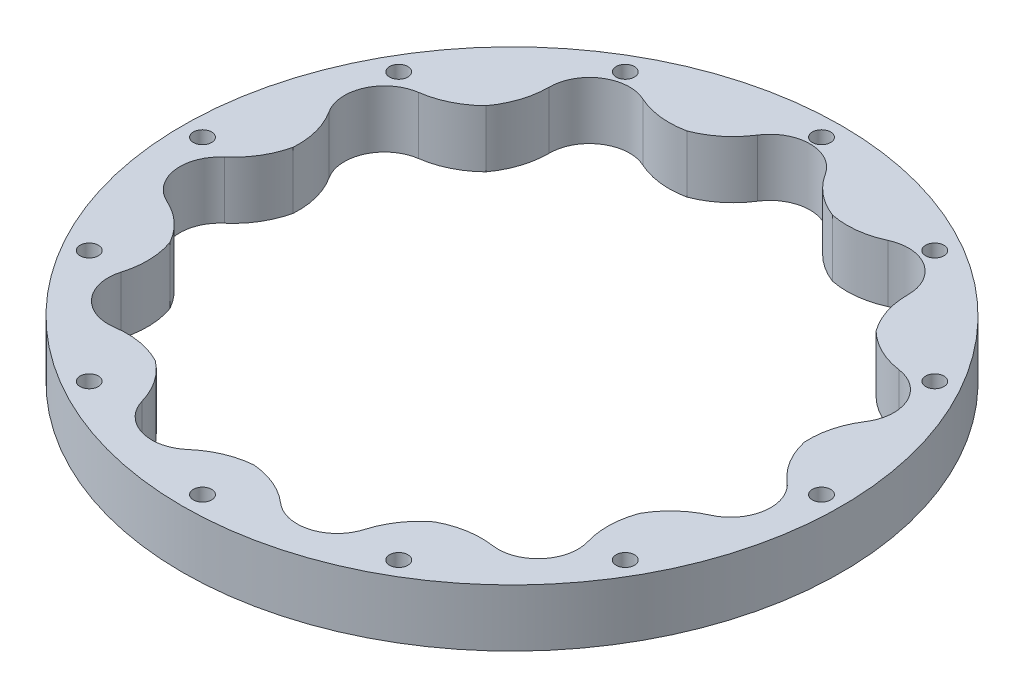
from build123d import *

# Parameters (mm, degrees)
SKETCH1_R           = 57.5
SKETCH1_R_2         = 1.6
BOSS_EXTRUDE1_DEPTH = 10
FILLET1_R           = 14


with BuildPart() as part:
    # Sketch1 → Boss-Extrude1 (new body)
    with BuildSketch(Plane(origin=(0, 0, 0), x_dir=(1, 0, 0), z_dir=(0, 1, 0))):
        with Locations(Location((0, 0, 0), (0, 0, 270))):
            Circle(SKETCH1_R)
        with Locations(Location((-27, -46.765371804, 0), (0, 0, 270))):
            Circle(SKETCH1_R_2, mode=Mode.SUBTRACT)
        with Locations(Location((-46.765371804, -27, 0), (0, 0, 270))):
            Circle(SKETCH1_R_2, mode=Mode.SUBTRACT)
        with Locations(Location((-54, 0, 0), (0, 0, 270))):
            Circle(SKETCH1_R_2, mode=Mode.SUBTRACT)
        with Locations(Location((0, -54, 0), (0, 0, 270))):
            Circle(SKETCH1_R_2, mode=Mode.SUBTRACT)
        with Locations(Location((27, -46.765371804, 0), (0, 0, 270))):
            Circle(SKETCH1_R_2, mode=Mode.SUBTRACT)
        with Locations(Location((46.765371804, -27, 0), (0, 0, 270))):
            Circle(SKETCH1_R_2, mode=Mode.SUBTRACT)
        with Locations(Location((-46.765371804, 27, 0), (0, 0, 270))):
            Circle(SKETCH1_R_2, mode=Mode.SUBTRACT)
        with Locations(Location((-27, 46.765371804, 0), (0, 0, 270))):
            Circle(SKETCH1_R_2, mode=Mode.SUBTRACT)
        with BuildLine():
            ThreePointArc((43.337291938, 12.119369929), (44.541964885, 6.404167722), (44.996248187, 0.581075772))
            ThreePointArc((44.996248187, 0.581075772), (49.649801174, -1.617727663), (51.541964885, -6.404167722))
            ThreePointArc((51.541964885, -6.404167722), (48.916629323, -11.868809619), (43.009876012, -13.234446171))
            ThreePointArc((43.009876012, -13.234446171), (40.933439791, -18.693675585), (38.167406032, -23.837976356))
            ThreePointArc((38.167406032, -23.837976356), (40.258159872, -26.3152212), (41.008730846, -29.468733028))
            ThreePointArc((41.008730846, -29.468733028), (36.666623102, -35.944503928), (29.027128345, -34.386419122))
            ThreePointArc((29.027128345, -34.386419122), (24.328836786, -37.856408977), (19.22068214, -40.688639423))
            ThreePointArc((19.22068214, -40.688639423), (19.562695248, -41.91207899), (19.677965058, -43.177183813))
            ThreePointArc((19.677965058, -43.177183813), (13.403758509, -50.139455271), (5.828472525, -44.620946965))
            ThreePointArc((5.828472525, -44.620946965), (0, -45), (-5.828472525, -44.620946965))
            ThreePointArc((-5.828472525, -44.620946965), (-14.650092956, -49.893634628), (-19.22068214, -40.688639423))
            ThreePointArc((-19.22068214, -40.688639423), (-24.328836785, -37.856408977), (-29.027128345, -34.386419122))
            ThreePointArc((-29.027128345, -34.386419122), (-39.298977866, -34.052758165), (-38.167406032, -23.837976356))
            ThreePointArc((-38.167406032, -23.837976356), (-40.933439791, -18.693675585), (-43.009876012, -13.234446171))
            ThreePointArc((-43.009876012, -13.234446171), (-51.470714978, -7.40037159), (-44.996248187, 0.581075772))
            ThreePointArc((-44.996248187, 0.581075772), (-44.541964885, 6.404167722), (-43.337291938, 12.119369929))
            ThreePointArc((-43.337291938, 12.119369929), (-47.300863758, 21.601580676), (-37.539099471, 24.815640449))
            ThreePointArc((-37.539099471, 24.815640449), (-34.008730846, 29.468733028), (-29.905423881, 33.625371708))
            ThreePointArc((-29.905423881, 33.625371708), (-28.113322508, 43.745183707), (-18.163551911, 41.171414622))
            ThreePointArc((-18.163551911, 41.171414622), (-12.677965058, 43.177183813), (-6.978795043, 44.455555556))
            ThreePointArc((-6.978795043, 44.455555556), (-0.272428616, 51.994696752), (7, 45))
            ThreePointArc((7, 45), (6.994696752, 44.727571384), (6.978795043, 44.455555556))
            ThreePointArc((6.978795043, 44.455555556), (12.677965058, 43.177183813), (18.163551911, 41.171414622))
            ThreePointArc((18.163551911, 41.171414622), (26.038077243, 44.644523374), (31.328836786, 37.856408977))
            ThreePointArc((31.328836786, 37.856408977), (30.963447161, 35.624381834), (29.905423881, 33.625371708))
            ThreePointArc((29.905423881, 33.625371708), (34.008730846, 29.468733028), (37.539099471, 24.815640449))
            ThreePointArc((37.539099471, 24.815640449), (44.485876825, 24.725274968), (47.933439791, 18.693675585))
            ThreePointArc((47.933439791, 18.693675585), (46.670467115, 14.68287548), (43.337291938, 12.119369929))
        make_face(mode=Mode.SUBTRACT)
        with Locations(Location((54, 0, 0), (0, 0, 270))):
            Circle(SKETCH1_R_2, mode=Mode.SUBTRACT)
        with Locations(Location((46.765371804, 27, 0), (0, 0, 270))):
            Circle(SKETCH1_R_2, mode=Mode.SUBTRACT)
        with Locations(Location((0, 54, 0), (0, 0, 270))):
            Circle(SKETCH1_R_2, mode=Mode.SUBTRACT)
        with Locations(Location((27, 46.765371804, 0), (0, 0, 270))):
            Circle(SKETCH1_R_2, mode=Mode.SUBTRACT)
    extrude(amount=BOSS_EXTRUDE1_DEPTH)

    # Fillet1
    # the kernel refuses this fillet: 14 mm, written as the material it takes off along each edge
    with BuildSketch(Plane(origin=(43.009876012, -16.77410228, 13.234446171), x_dir=(-0.3645348982341331, 0, 0.9311897271605987), z_dir=(0, 1, 0)), Plane(origin=(43.337291938, -16.77410228, -12.119369929), x_dir=(0.19677290431862063, 0, 0.9804490930823564), z_dir=(0, 1, 0)), Plane(origin=(29.027128345, -16.77410228, 34.386419122), x_dir=(-0.8101054462780665, 0, 0.586284202337582), z_dir=(0, 1, 0)), Plane(origin=(5.828472525, -16.77410228, 44.620946965), x_dir=(-0.9984732390602963, 0, 0.05523758575861507), z_dir=(0, 1, 0)), Plane(origin=(-19.22068214, -16.77410228, 40.688639423), x_dir=(-0.8698328333156817, 0, -0.4933465740085904), z_dir=(0, 1, 0)), Plane(origin=(-38.167406032, -16.77410228, 23.837976356), x_dir=(-0.46502664893844664, 0, -0.8852966823483972), z_dir=(0, 1, 0)), Plane(origin=(-44.996248187, -16.77410228, -0.581075772), x_dir=(0.0874222107554752, 0, -0.99617134925003), z_dir=(0, 1, 0)), Plane(origin=(-37.539099471, -16.77410228, -24.815640449), x_dir=(0.6121151362303556, 0, -0.7907686513751624), z_dir=(0, 1, 0)), Plane(origin=(-18.163551911, -16.77410228, -41.171414622), x_dir=(0.9424658309509625, 0, -0.334302493992958), z_dir=(0, 1, 0)), Plane(origin=(6.978795043, -16.77410228, -44.455555556), x_dir=(0.9735902834899675, 0, 0.22830234316345693), z_dir=(0, 1, 0))) as fillet1_piece_1:
        with BuildLine():
            CenterArc((7.753362832, 13.961040239), FILLET1_R, 225.679308165, 40.045235058)
            ThreePointArc((-2.028069047, 3.944873787), (-0.693306264, 2.137324059), (0, 0))
            ThreePointArc((0, 0), (3.354820456, 0.125227803), (6.709640912, 0))
        make_face()
    extrude(amount=43.54820456, mode=Mode.SUBTRACT)
    with BuildSketch(Plane(origin=(44.996248187, -16.77410228, -0.581075772), x_dir=(0.9259201789863998, 0, 0.37771923719317424), z_dir=(0, 1, 0)), Plane(origin=(37.539099471, -16.77410228, -24.815640449), x_dir=(0.9831440588568181, 0, -0.18283259975874497), z_dir=(0, 1, 0)), Plane(origin=(38.167406032, -16.77410228, 23.837976356), x_dir=(0.5747231845271455, 0, 0.8183478851729116), z_dir=(0, 1, 0)), Plane(origin=(19.22068214, -16.77410228, 40.688639423), x_dir=(0.041055639780420296, 0, 0.9991568617800813), z_dir=(0, 1, 0)), Plane(origin=(-5.828472525, -16.77410228, 44.620946965), x_dir=(-0.5056467805113274, 0, 0.8627405944770012), z_dir=(0, 1, 0)), Plane(origin=(-29.027128345, -16.77410228, 34.386419122), x_dir=(-0.8918099207200904, 0, 0.4524102842611189), z_dir=(0, 1, 0)), Plane(origin=(-43.009876012, -16.77410228, 13.234446171), x_dir=(-0.994829712327915, 0, -0.10155709462936494), z_dir=(0, 1, 0)), Plane(origin=(-43.337291938, -16.77410228, -12.119369929), x_dir=(-0.7819980994024467, 0, -0.62328081354311), z_dir=(0, 1, 0)), Plane(origin=(-29.905423881, -16.77410228, -33.625371708), x_dir=(-0.3208876152512941, 0, -0.9471172780486783), z_dir=(0, 1, 0)), Plane(origin=(18.163551911, -16.77410228, -41.171414622), x_dir=(0.7282266466043301, 0, -0.6853363781205636), z_dir=(0, 1, 0)), Plane(origin=(-6.978795043, -16.77410228, -44.455555556), x_dir=(0.24210241945853378, 0, -0.9702506987847646), z_dir=(0, 1, 0))) as fillet1_piece_2:
        with BuildLine():
            CenterArc((8.87132307, 13.278738899), FILLET1_R, 211.483261097, 40.045235058)
            ThreePointArc((-3.067775786, 5.967246676), (-1.422516032, 3.040879878), (0, 0))
            ThreePointArc((0, 0), (2.217830767, 0.36063055), (4.435661535, 0))
        make_face()
    extrude(amount=43.54820456, mode=Mode.SUBTRACT)
    with BuildSketch(Plane(origin=(29.905423881, -16.77410228, -33.625371708), x_dir=(0.3208876152513925, 0, -0.9471172780486449), z_dir=(0, 1, 0))) as fillet1_piece_3:
        with BuildLine():
            CenterArc((8.87132307, -13.278738899), FILLET1_R, 108.471503845, 40.045235058)
            ThreePointArc((-3.067775786, -5.967246676), (-1.422516032, -3.040879878), (0, 0))
            ThreePointArc((0, 0), (2.217830767, -0.36063055), (4.435661535, 0))
        make_face()
    extrude(amount=43.54820456, mode=Mode.SUBTRACT)


solid = part.part
